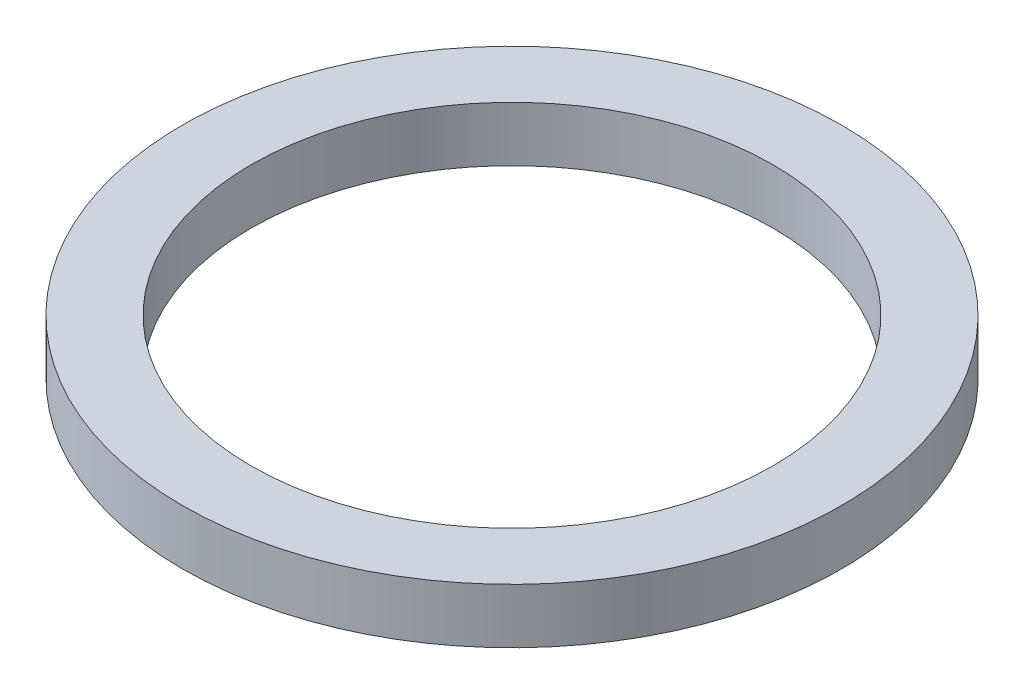
from build123d import *

# Parameters (mm, degrees)
SKETCH1_R           = 60
BOSS_EXTRUDE1_DEPTH = 10
SKETCH2_R           = 47.5
CUT_EXTRUDE1_DEPTH  = 86.440037453


with BuildPart() as part:
    # Sketch1 → Boss-Extrude1 (new body)
    with BuildSketch(Plane(origin=(0, 0, 0), x_dir=(1, 0, 0), z_dir=(0, 1, 0))):
        Circle(SKETCH1_R)
    extrude(amount=BOSS_EXTRUDE1_DEPTH)

    # Sketch2 → Cut-Extrude1 (cut, through all)
    with BuildSketch(Plane(origin=(0, 0, 0), x_dir=(1, 0, 0), z_dir=(0, 1, 0))):
        Circle(SKETCH2_R)
    extrude(amount=CUT_EXTRUDE1_DEPTH, mode=Mode.SUBTRACT)


solid = part.part
